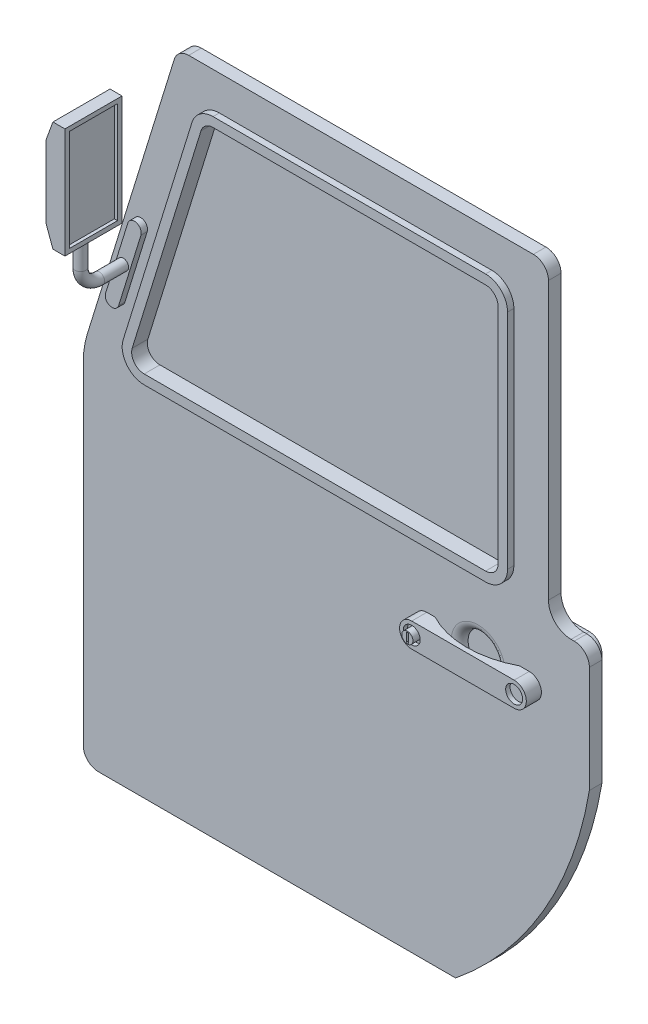
from build123d import *

# Parameters (mm, degrees)
BOSS_EXTRUDE1_DEPTH  = 20
BOSS_EXTRUDE2_DEPTH  = 20
BOSS_EXTRUDE3_DEPTH  = 40
CUT_EXTRUDE1_DEPTH   = 694.636580883
SKETCH5_R            = 40
BOSS_EXTRUDE4_DEPTH  = 30
SKETCH6_R            = 30
BOSS_EXTRUDE5_DEPTH  = 20
BOSS_EXTRUDE6_DEPTH  = 10
SKETCH8_R            = 13.5
BOSS_EXTRUDE7_DEPTH  = 14
DOME1_FACE_RADIUS    = 13.5
DOME1_HEIGHT         = 30
SKETCH9_R            = 12
CUT_EXTRUDE2_DEPTH   = 7
BOSS_EXTRUDE8_DEPTH  = 30
CUT_EXTRUDE3_DEPTH   = 706.151386516
SKETCH12_R           = 13.5
CUT_EXTRUDE4_DEPTH   = 10
BOSS_EXTRUDE9_DEPTH  = 10
BOSS_EXTRUDE10_DEPTH = 24
SKETCH15_R           = 28.797977261
CUT_EXTRUDE5_DEPTH   = 13
CUT_EXTRUDE6_DEPTH   = 742.81338331
SKETCH17_R           = 13.5
CUT_EXTRUDE7_DEPTH   = 7
SKETCH18_R           = 8.875268811
BOSS_EXTRUDE11_DEPTH = 14
SKETCH19_W           = 3.347666912
SKETCH19_H           = 14.589400007
CUT_EXTRUDE8_DEPTH   = 14
FILLET1_R            = 14
SKETCH20_R           = 41.028008726
CUT_EXTRUDE9_DEPTH   = 17
FILLET2_R            = 14
BOSS_EXTRUDE12_DEPTH = 10
SKETCH26_R           = 8.519654293
SKETCH29_W           = 90.749848766
SKETCH29_H           = 175.138264735
BOSS_EXTRUDE13_DEPTH = 30
CHAMFER1_SIZE        = 10.919107028
CHAMFER1_SIZE_2      = 30
SKETCH30_W           = 76.749848766
SKETCH30_H           = 161.138264735
CUT_EXTRUDE10_DEPTH  = 5
BOSS_EXTRUDE14_DEPTH = 5


with BuildPart() as part:
    # Sketch1 → Boss-Extrude1 (new body)
    with BuildSketch(Plane.XY):
        with BuildLine():
            Line((-435.802172671, 31.499450535), (-435.802172671, -495.847444832))
            ThreePointArc((-435.802172671, -495.847444832), (-428.772735419, -512.81800758), (-411.802172671, -519.847444832))
            Line((-411.802172671, -519.847444832), (156.082330181, -519.847444832))
            ThreePointArc((156.082330181, -519.847444832), (295.823055216, -357.111291989), (368.652372784, -155.352980691))
            Line((368.652372784, -155.352980691), (368.652372784, 14.152555168))
            ThreePointArc((368.652372784, 14.152555168), (361.622935532, 31.123117917), (344.652372784, 38.152555168))
            Line((344.652372784, 38.152555168), (339.652372784, 38.152555168))
            ThreePointArc((339.652372784, 38.152555168), (314.196528661, 48.696711046), (303.652372784, 74.152555168))
            Line((303.652372784, 74.152555168), (303.652372784, 514.152555168))
            ThreePointArc((303.652372784, 514.152555168), (296.622935532, 531.123117917), (279.652372784, 538.152555168))
            Line((279.652372784, 538.152555168), (-268.219980748, 538.152555168))
            ThreePointArc((-268.219980748, 538.152555168), (-282.466095797, 533.46701105), (-291.149644132, 521.239905669))
            Line((-291.149644132, 521.239905669), (-429.380152972, 74.023553537))
            ThreePointArc((-429.380152972, 74.023553537), (-434.187616385, 53.002599567), (-435.802172671, 31.499450535))
        make_face()
    extrude(amount=BOSS_EXTRUDE1_DEPTH)

    # Sketch2 → Boss-Extrude2 (add)
    with BuildSketch(Plane(origin=(0, 0, 0), x_dir=(-1, 0, 0), z_dir=(0, 0, -1))):
        with BuildLine():
            Line((-253.652372784, 488.152555168), (-253.652372784, 74.152555168))
            ThreePointArc((-253.652372784, 74.152555168), (-271.821701255, 21.284795617), (-318.652372784, -9.24408745))
            Line((-318.652372784, -9.24408745), (-318.652372784, -151.130553633))
            ThreePointArc((-318.652372784, -151.130553633), (-255.946207235, -326.157805935), (-137.963624113, -469.847444832))
            Line((-137.963624113, -469.847444832), (385.802172671, -469.847444832))
            Line((385.802172671, -469.847444832), (385.802172671, 31.499450535))
            ThreePointArc((385.802172671, 31.499450535), (384.748226206, 45.536228375), (381.610020923, 59.258239994))
            Line((381.610020923, 59.258239994), (249.042687142, 488.152555168))
            Line((249.042687142, 488.152555168), (-253.652372784, 488.152555168))
        make_face()
    extrude(amount=BOSS_EXTRUDE2_DEPTH)

    # Sketch3 → Boss-Extrude3 (add)
    with BuildSketch(Plane(origin=(0, 0, -20), x_dir=(-1, 0, 0), z_dir=(0, 0, -1))):
        with BuildLine():
            Line((-288.652372784, -16.70447538), (355.802172671, -16.70447538))
            ThreePointArc((355.802172671, -16.70447538), (369.944308295, -22.562339756), (375.802172671, -36.70447538))
            Line((375.802172671, -36.70447538), (375.802172671, -459.847444832))
            Line((375.802172671, -459.847444832), (-134.227832102, -459.847444832))
            ThreePointArc((-134.227832102, -459.847444832), (-247.946039922, -319.989020839), (-308.652372784, -150.262915887))
            Line((-308.652372784, -150.262915887), (-308.652372784, -36.70447538))
            ThreePointArc((-308.652372784, -36.70447538), (-302.794508408, -22.562339756), (-288.652372784, -16.70447538))
        make_face()
    extrude(amount=BOSS_EXTRUDE3_DEPTH)

    # Sketch4 → Cut-Extrude1 (cut, through all)
    with BuildSketch(Plane(origin=(0, 0, -20), x_dir=(-1, 0, 0), z_dir=(0, 0, -1))):
        with BuildLine():
            Line((-213.652372784, 74.152555168), (328.957340336, 74.152555168))
            ThreePointArc((328.957340336, 74.152555168), (345.052720237, 82.280792627), (348.065393156, 100.058680585))
            Line((348.065393156, 100.058680585), (238.647211337, 454.058680585))
            ThreePointArc((238.647211337, 454.058680585), (231.410921059, 464.24793507), (219.539158518, 468.152555168))
            Line((219.539158518, 468.152555168), (-213.652372784, 468.152555168))
            ThreePointArc((-213.652372784, 468.152555168), (-227.794508408, 462.294690792), (-233.652372784, 448.152555168))
            Line((-233.652372784, 448.152555168), (-233.652372784, 94.152555168))
            ThreePointArc((-233.652372784, 94.152555168), (-227.794508408, 80.010419545), (-213.652372784, 74.152555168))
        make_face()
    extrude(amount=-CUT_EXTRUDE1_DEPTH, mode=Mode.SUBTRACT)

    # Sketch5 → Boss-Extrude4 (add)
    with BuildSketch(Plane(origin=(0, 0, -60), x_dir=(-1, 0, 0), z_dir=(0, 0, -1))):
        with Locations(Location((-226.366995514, -106.132409766, 0), (0, 0, 180))):
            Circle(SKETCH5_R)
    extrude(amount=BOSS_EXTRUDE4_DEPTH)

    # Sketch6 → Boss-Extrude5 (add)
    with BuildSketch(Plane(origin=(0, 0, -90), x_dir=(-1, 0, 0), z_dir=(0, 0, -1))):
        with Locations((-226.366995514, -106.132409766)):
            Circle(SKETCH6_R)
    extrude(amount=BOSS_EXTRUDE5_DEPTH)

    # Sketch7 → Boss-Extrude6 (add)
    with BuildSketch(Plane(origin=(0, 0, -110), x_dir=(-1, 0, 0), z_dir=(0, 0, -1))):
        with BuildLine():
            Line((-219.947331201, -88.781965676), (-73.087503259, -143.120102015))
            ThreePointArc((-73.087503259, -143.120102015), (-62.156723482, -166.890210418), (-85.926831885, -177.820990194))
            Line((-85.926831885, -177.820990194), (-232.786659827, -123.482853856))
            ThreePointArc((-232.786659827, -123.482853856), (-243.717439603, -99.712745453), (-219.947331201, -88.781965676))
        make_face()
    extrude(amount=BOSS_EXTRUDE6_DEPTH)

    # Sketch8 → Boss-Extrude7 (add)
    with BuildSketch(Plane(origin=(0, 0, -120), x_dir=(-1, 0, 0), z_dir=(0, 0, -1))):
        with Locations((-79.507167572, -160.470546105)):
            Circle(SKETCH8_R)
    extrude(amount=BOSS_EXTRUDE7_DEPTH)

    # Dome1: a dome of height H over a round flat face of radius A is a cap of a sphere of radius (A * A + H * H) / (2 * H)
    dome1_r = (DOME1_FACE_RADIUS * DOME1_FACE_RADIUS + DOME1_HEIGHT * DOME1_HEIGHT) / (2 * DOME1_HEIGHT)
    dome1_base = Plane((79.507167572, -160.470546105, -134), z_dir=(0, 0, -1))
    with Locations(dome1_base.offset(DOME1_HEIGHT - dome1_r)):
        dome1_ball = Sphere(dome1_r, mode=Mode.PRIVATE)
    add(split(dome1_ball, bisect_by=dome1_base, keep=Keep.TOP, mode=Mode.PRIVATE))

    # Sketch9 → Cut-Extrude2 (cut)
    with BuildSketch(Plane(origin=(0, 0, -120), x_dir=(-1, 0, 0), z_dir=(0, 0, -1))):
        with Locations((-226.366995514, -106.132409766)):
            Circle(SKETCH9_R)
    extrude(amount=-CUT_EXTRUDE2_DEPTH, mode=Mode.SUBTRACT)

    # Sketch10 → Boss-Extrude8 (add)
    with BuildSketch(Plane(origin=(0, 0, -60), x_dir=(-1, 0, 0), z_dir=(0, 0, -1))):
        with BuildLine():
            Line((161.548299015, -71.581467344), (327.499904589, -171.446150345))
            ThreePointArc((327.499904589, -171.446150345), (335.41072922, -203.26524497), (303.591634595, -211.1760696))
            Line((303.591634595, -211.1760696), (137.64002902, -111.3113866))
            ThreePointArc((137.64002902, -111.3113866), (129.72920439, -79.492291975), (161.548299015, -71.581467344))
        make_face()
    extrude(amount=BOSS_EXTRUDE8_DEPTH)

    # Sketch11 → Cut-Extrude3 (cut, through all)
    with BuildSketch(Plane(origin=(-11.324517885, 18.818684132, 0), x_dir=(0.8568231560670643, 0.515610394801419, 0), z_dir=(-0.515610394801419, 0.8568231560670643, 0))):
        with BuildLine():
            Line((-355.692027555, 60), (-183.512931338, 60))
            ThreePointArc((-183.512931338, 60), (-269.602479447, 79.236024987), (-355.692027555, 60))
        make_face()
    extrude(amount=-CUT_EXTRUDE3_DEPTH, mode=Mode.SUBTRACT)

    # Sketch12 → Cut-Extrude4 (cut)
    with BuildSketch(Plane(origin=(0, 0, -90), x_dir=(-1, 0, 0), z_dir=(0, 0, -1))):
        with Locations((149.594164018, -91.446426972)):
            Circle(SKETCH12_R)
        with Locations((315.545769592, -191.311109972)):
            Circle(SKETCH12_R)
    extrude(amount=-CUT_EXTRUDE4_DEPTH, mode=Mode.SUBTRACT)

    # Sketch13 → Boss-Extrude9 (add)
    with BuildSketch(Plane.XY.offset(20)):
        with BuildLine():
            Line((-362.39643277, 104.488274648), (-252.978250952, 458.488274648))
            ThreePointArc((-252.978250952, 458.488274648), (-240.314742965, 476.319469996), (-219.539158518, 483.152555168))
            Line((-219.539158518, 483.152555168), (213.652372784, 483.152555168))
            ThreePointArc((213.652372784, 483.152555168), (238.401110125, 472.90129251), (248.652372784, 448.152555168))
            Line((248.652372784, 448.152555168), (248.652372784, 94.152555168))
            ThreePointArc((248.652372784, 94.152555168), (238.401110125, 69.403817827), (213.652372784, 59.152555168))
            Line((213.652372784, 59.152555168), (-328.957340336, 59.152555168))
            ThreePointArc((-328.957340336, 59.152555168), (-357.124255163, 73.376970722), (-362.39643277, 104.488274648))
        make_face()
        with BuildLine():
            Line((213.652372784, 74.152555168), (-328.957340336, 74.152555168))
            ThreePointArc((-328.957340336, 74.152555168), (-345.052720237, 82.280792627), (-348.065393156, 100.058680585))
            Line((-348.065393156, 100.058680585), (-238.647211337, 454.058680585))
            ThreePointArc((-238.647211337, 454.058680585), (-231.410921059, 464.24793507), (-219.539158518, 468.152555168))
            Line((-219.539158518, 468.152555168), (213.652372784, 468.152555168))
            ThreePointArc((213.652372784, 468.152555168), (227.794508408, 462.294690792), (233.652372784, 448.152555168))
            Line((233.652372784, 448.152555168), (233.652372784, 94.152555168))
            ThreePointArc((233.652372784, 94.152555168), (227.794508408, 80.010419545), (213.652372784, 74.152555168))
        make_face(mode=Mode.SUBTRACT)
    extrude(amount=BOSS_EXTRUDE9_DEPTH)

    # Sketch14 → Boss-Extrude10 (add)
    with BuildSketch(Plane.XY.offset(20)):
        with BuildLine():
            Line((273.095830693, -78.017287965), (110.314134939, -78.017287965))
            ThreePointArc((110.314134939, -78.017287965), (90.962464814, -58.66561784), (110.314134939, -39.313947716))
            Line((110.314134939, -39.313947716), (273.095830693, -39.313947716))
            ThreePointArc((273.095830693, -39.313947716), (292.447500817, -58.66561784), (273.095830693, -78.017287965))
        make_face()
    extrude(amount=BOSS_EXTRUDE10_DEPTH)

    # Sketch15 → Cut-Extrude5 (cut)
    with BuildSketch(Plane.XY.offset(20)):
        with Locations((191.704982816, -58.66561784)):
            Circle(SKETCH15_R)
    extrude(amount=-CUT_EXTRUDE5_DEPTH, mode=Mode.SUBTRACT)

    # Sketch16 → Cut-Extrude6 (cut, through all)
    with BuildSketch(Plane(origin=(0, -39.313947716, 0), x_dir=(1, 0, 0), z_dir=(0, 1, 0))):
        with BuildLine():
            Line((123.235916311, -20), (257.889827344, -20))
            ThreePointArc((257.889827344, -20), (190.562871827, -36.629945292), (123.235916311, -20))
        make_face()
    extrude(amount=-CUT_EXTRUDE6_DEPTH, mode=Mode.SUBTRACT)

    # Sketch17 → Cut-Extrude7 (cut)
    with BuildSketch(Plane.XY.offset(44)):
        with Locations((110.314134939, -58.66561784)):
            Circle(SKETCH17_R)
        with Locations((273.095830693, -58.66561784)):
            Circle(SKETCH17_R)
    extrude(amount=-CUT_EXTRUDE7_DEPTH, mode=Mode.SUBTRACT)

    # Sketch18 → Boss-Extrude11 (add)
    with BuildSketch(Plane.XY.offset(37)):
        with Locations((110.314134939, -58.66561784)):
            Circle(SKETCH18_R)
    extrude(amount=BOSS_EXTRUDE11_DEPTH)

    # Sketch19 → Cut-Extrude8 (cut)
    with BuildSketch(Plane.XY.offset(51)):
        with Locations((110.314134939, -58.665617841)):
            Rectangle(SKETCH19_W, SKETCH19_H)
    extrude(amount=-CUT_EXTRUDE8_DEPTH, mode=Mode.SUBTRACT)

    # Fillet1
    # the kernel refuses this fillet: 14 mm, written as the material it takes off along each edge
    with BuildSketch(Plane(origin=(191.704982816, -58.66561784, 20), x_dir=(1, 0, 0), z_dir=(0, 1, 0))) as fillet1_piece_1:
        with BuildLine():
            CenterArc((42.762217304, 14), FILLET1_R, 184.096043758, 85.903956242)
            Line((28.797977261, 13), (28.51869246, 12.98))
            ThreePointArc((28.51869246, 12.98), (28.517977261, 6.5), (28.517977261, 0))
            Line((28.517977261, 0), (28.797977261, -0.28))
            Line((28.797977261, -0.28), (42.762217304, -0.28))
            Line((42.762217304, -0.28), (42.762217304, 0))
        make_face()
    revolve(axis=Axis((191.704982816, -58.66561784, 20), (0, 0, -1)), mode=Mode.SUBTRACT)

    # Sketch20 → Cut-Extrude9 (cut)
    with BuildSketch(Plane(origin=(0, 0, -60), x_dir=(-1, 0, 0), z_dir=(0, 0, -1))):
        with Locations((232.569966805, -141.378768472)):
            Circle(SKETCH20_R)
    extrude(amount=-CUT_EXTRUDE9_DEPTH, mode=Mode.SUBTRACT)

    # Fillet2
    fillet2_edges = [part.edges().sort_by_distance(p)[0] for p in [
        (-191.541958079, -141.378768472, -60),
    ]]
    fillet(fillet2_edges, radius=FILLET2_R)

    # Sketch21 → Boss-Extrude12 (add)
    with BuildSketch(Plane.XY.offset(20)):
        with BuildLine():
            Line((-334.124958182, 262.568741263), (-369.563765553, 147.913776237))
            ThreePointArc((-369.563765553, 147.913776237), (-383.196190209, 140.718885446), (-390.391080999, 154.351310101))
            Line((-390.391080999, 154.351310101), (-354.952273627, 269.006275128))
            ThreePointArc((-354.952273627, 269.006275128), (-341.319848972, 276.201165918), (-334.124958182, 262.568741263))
        make_face()
    extrude(amount=BOSS_EXTRUDE12_DEPTH)

    # Sweep1: sweep along a curve in space
    with BuildLine() as sweep1_path:
        Line((-362.25801959, 208.460025682, 30), (-362.25801959, 208.460025682, 68.096586479))
        ThreePointArc((-362.25801959, 208.460025682, 68.096586479), (-362.25801959, 217.246822247, 89.309789915), (-362.25801959, 238.460025682, 98.096586479))
        Line((-362.25801959, 238.460025682, 98.096586479), (-362.25801959, 354.403422549, 98.096586479))
        ThreePointArc((-362.25801959, 354.403422549, 98.096586479), (-356.400155214, 368.545558173, 98.096586479), (-342.25801959, 374.403422549, 98.096586479))
        Line((-342.25801959, 374.403422549, 98.096586479), (-341.471666924, 374.403422549, 98.096586479))
    # Sketch26 → Sweep1 (sweep)
    with BuildSketch(Plane.XY.offset(30)):
        with Locations((-362.25801959, 208.460025682)):
            Circle(SKETCH26_R)
    sweep(path=sweep1_path.line)

    # Sketch29 → Boss-Extrude13 (add)
    with BuildSketch(Plane(origin=(-341.471666924, 0, 0), x_dir=(0, 0, -1), z_dir=(1, 0, 0))):
        with Locations((-98.096586479, 374.40342255)):
            Rectangle(SKETCH29_W, SKETCH29_H)
    extrude(amount=-BOSS_EXTRUDE13_DEPTH)

    # Chamfer1
    # the kernel refuses this chamfer: 30, 10.919107028 mm, written as the material it takes off along each edge
    with BuildSketch(Plane(origin=(-371.471666924, 286.834290182, 221.297352839), x_dir=(0.9950833631817487, -0.0990409022520507, 0), z_dir=(0, 0, -1))) as chamfer1_piece_1_section:
        Polygon((CHAMFER1_SIZE * 0.99508336318, -CHAMFER1_SIZE * 0.0990409022519), (-CHAMFER1_SIZE_2 * 0.0990409022521, -CHAMFER1_SIZE_2 * 0.995083363182), (0, 0), align=None)
    chamfer1_piece_1 = extrude(amount=168.575690742, mode=Mode.PRIVATE)
    chamfer1_piece_1 = chamfer1_piece_1 - Plane(origin=(-362.25801959, 288.344279988, 98.096586479), x_dir=(1, 0, 0), z_dir=(0, 1, 0)) * Cylinder(8.519654293, 457, mode=Mode.PRIVATE)
    add(chamfer1_piece_1, mode=Mode.SUBTRACT)
    with BuildSketch(Plane(origin=(-371.471666924, 461.972554917, -25.10417988), x_dir=(-0.013184058198646627, -0.9999130865277316, 0), z_dir=(0, 0, 1))) as chamfer1_piece_2:
        Polygon((CHAMFER1_SIZE_2 * 0.999913086528, CHAMFER1_SIZE_2 * 0.0131840581986), (-CHAMFER1_SIZE * 0.0131840581986, CHAMFER1_SIZE * 0.999913086526), (0, 0), align=None)
    extrude(amount=246.401532719, mode=Mode.SUBTRACT)

    # Sketch30 → Cut-Extrude10 (cut)
    with BuildSketch(Plane(origin=(-341.471666924, 0, 0), x_dir=(0, 0, -1), z_dir=(1, 0, 0))):
        with Locations((-98.096586479, 374.40342255)):
            Rectangle(SKETCH30_W, SKETCH30_H)
    extrude(amount=-CUT_EXTRUDE10_DEPTH, mode=Mode.SUBTRACT)

    # Sketch32 → Boss-Extrude14 (add, symmetric)
    with BuildSketch(Plane.XY):
        with BuildLine():
            Line((248.652372784, 94.152555168), (248.652372784, 448.152555168))
            ThreePointArc((248.652372784, 448.152555168), (238.401110125, 472.90129251), (213.652372784, 483.152555168))
            Line((213.652372784, 483.152555168), (-219.539158518, 483.152555168))
            ThreePointArc((-219.539158518, 483.152555168), (-240.314742965, 476.319469996), (-252.978250952, 458.488274648))
            Line((-252.978250952, 458.488274648), (-362.39643277, 104.488274648))
            ThreePointArc((-362.39643277, 104.488274648), (-357.124255163, 73.376970722), (-328.957340336, 59.152555168))
            Line((-328.957340336, 59.152555168), (213.652372784, 59.152555168))
            ThreePointArc((213.652372784, 59.152555168), (238.401110125, 69.403817827), (248.652372784, 94.152555168))
        make_face()
    extrude(amount=BOSS_EXTRUDE14_DEPTH, both=True)


solid = part.part
